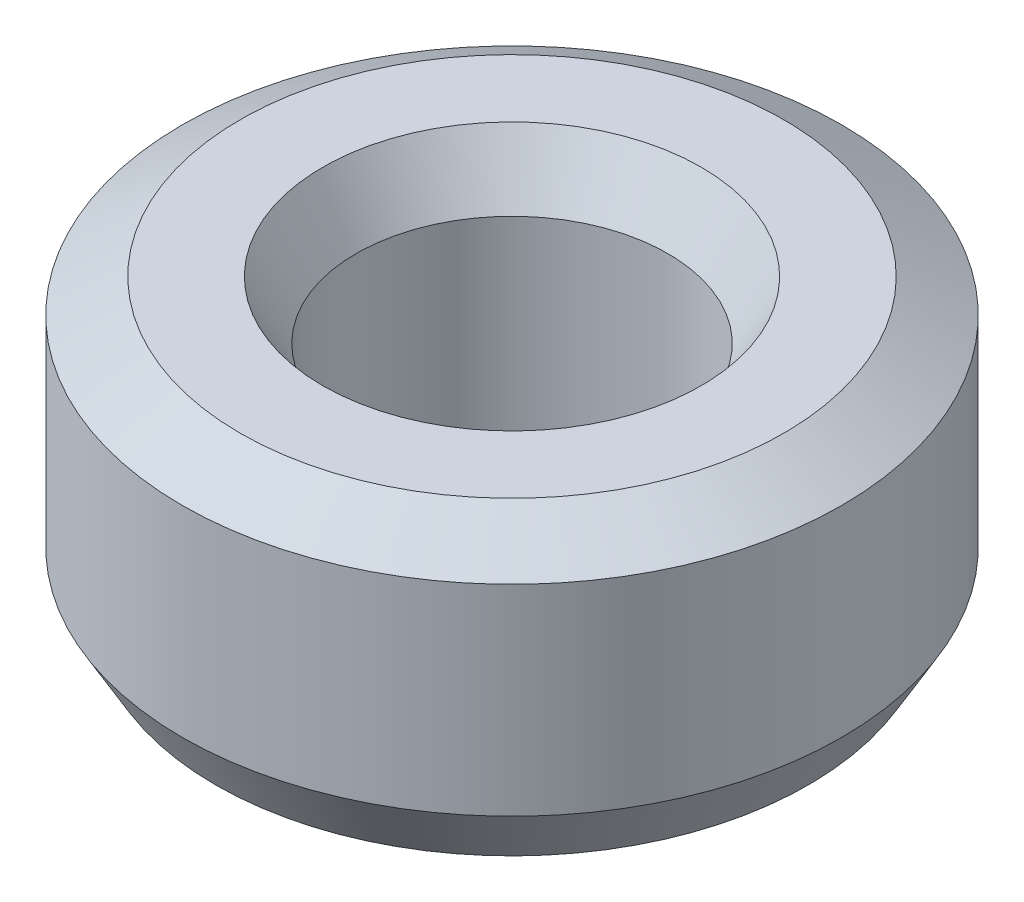
from build123d import *
from OCP.BRepFilletAPI import BRepFilletAPI_MakeChamfer

# Parameters (mm, degrees)
SKETCH1_R           = 12.5
BOSS_EXTRUDE1_DEPTH = 11.085555562
SKETCH2_R           = 5.906039449
CUT_EXTRUDE1_DEPTH  = 21.865990082
CHAMFER1_SIZE       = 1.26970566
CHAMFER1_SIZE2      = 2.199194713


with BuildPart() as part:
    # Sketch1 → Boss-Extrude1 (new body)
    with BuildSketch(Plane(origin=(0, 0, 0), x_dir=(1, 0, 0), z_dir=(0, 1, 0))):
        Circle(SKETCH1_R)
    extrude(amount=BOSS_EXTRUDE1_DEPTH)

    # Sketch2 → Cut-Extrude1 (cut, through all)
    with BuildSketch(Plane(origin=(0, 0, 0), x_dir=(1, 0, 0), z_dir=(0, 1, 0))):
        Circle(SKETCH2_R)
    extrude(amount=CUT_EXTRUDE1_DEPTH, mode=Mode.SUBTRACT)

    # Chamfer1: one chamfer whose edges measure the first distance from different faces: ONE call of the kernel's chamfer builder (chamfer() names one face for all edges)
    chamfer1_edges_1 = [part.edges().sort_by_distance(p)[0] for p in [
        (-5.906039449, 11.085555562, 0),
    ]]
    chamfer1_side_1 = [part.faces().sort_by_distance(p)[0] for p in [
        (-12.146446609, 11.085555562, 0),
    ]]
    chamfer1_edges_2 = [part.edges().sort_by_distance(p)[0] for p in [
        (-5.906039449, 0, 0),
    ]]
    chamfer1_side_2 = [part.faces().sort_by_distance(p)[0] for p in [
        (-5.906039449, 5.542777781, 0),
    ]]
    chamfer1_edges_3 = [part.edges().sort_by_distance(p)[0] for p in [
        (-12.5, 0, 0),
    ]]
    chamfer1_side_3 = [part.faces().sort_by_distance(p)[0] for p in [
        (-12.146446609, 0, 0),
    ]]
    chamfer1_edges_4 = [part.edges().sort_by_distance(p)[0] for p in [
        (-12.5, 11.085555562, 0),
    ]]
    chamfer1_side_4 = [part.faces().sort_by_distance(p)[0] for p in [
        (-12.5, 5.542777781, 0),
    ]]
    chamfer1 = BRepFilletAPI_MakeChamfer(part.part.solid().wrapped)
    for e in chamfer1_edges_1:
        chamfer1.Add(CHAMFER1_SIZE, CHAMFER1_SIZE2, e.wrapped, chamfer1_side_1[0].wrapped)  # the first distance lies on this face
    for e in chamfer1_edges_2:
        chamfer1.Add(CHAMFER1_SIZE, CHAMFER1_SIZE2, e.wrapped, chamfer1_side_2[0].wrapped)  # the first distance lies on this face
    for e in chamfer1_edges_3:
        chamfer1.Add(CHAMFER1_SIZE, CHAMFER1_SIZE2, e.wrapped, chamfer1_side_3[0].wrapped)  # the first distance lies on this face
    for e in chamfer1_edges_4:
        chamfer1.Add(CHAMFER1_SIZE, CHAMFER1_SIZE2, e.wrapped, chamfer1_side_4[0].wrapped)  # the first distance lies on this face
    add(Compound.cast(chamfer1.Shape()), mode=Mode.REPLACE)


solid = part.part
